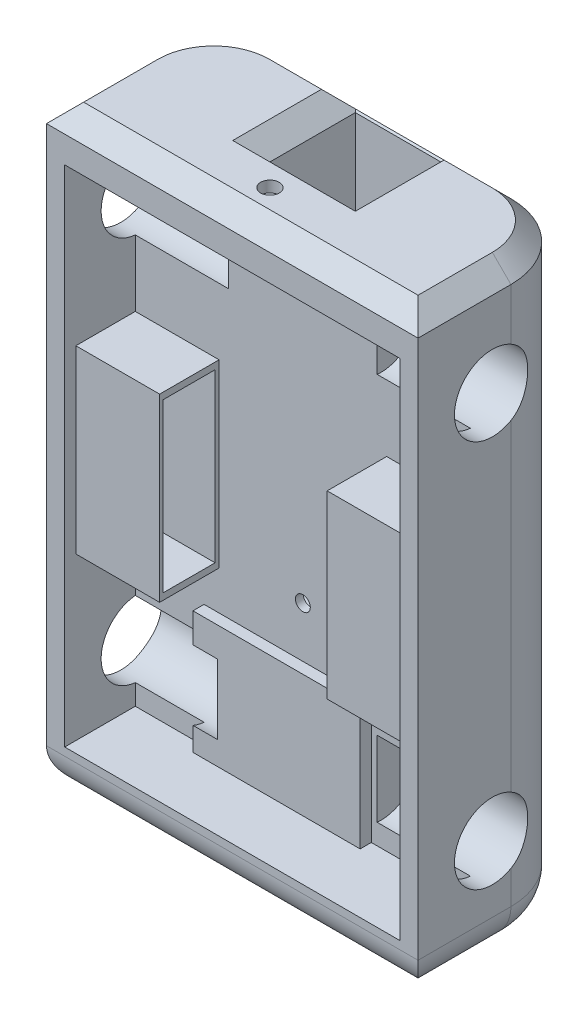
from build123d import *

# Parameters (mm, degrees)
SKETCH1_W             = 100
SKETCH1_H             = 160
BOSS_EXTRUDE1_DEPTH   = 20
BOSS_EXTRUDE2_DEPTH   = 160
FILLET4_R             = 10
SKETCH11_W            = 90.184018432
SKETCH11_H            = 135.686144012
CUT_EXTRUDE3_DEPTH    = 19
SKETCH12_W            = 23
SKETCH12_H            = 23
CUT_EXTRUDE4_DEPTH    = 110
SKETCH13_RX           = 15.4640355
SKETCH13_RY           = 8.1946903
CUT_EXTRUDE5_DEPTH    = 4
SKETCH15_R            = 2
CUT_EXTRUDE6_DEPTH    = 4
SKETCH22_W            = 22.546004608
SKETCH22_H            = 48.532413032
BOSS_EXTRUDE7_DEPTH   = 16
BOSS_EXTRUDE7_2_DEPTH = 16
SKETCH26_W            = 45
SKETCH26_H            = 33
BOSS_EXTRUDE8_DEPTH   = 3
SKETCH27_R            = 4
CUT_EXTRUDE13_DEPTH   = 3
SKETCH28_R            = 2.506731261
CUT_EXTRUDE14_DEPTH   = 3
SKETCH14_R            = 10.2
CUT_EXTRUDE15_DEPTH   = 30
SKETCH17_R            = 10.2
CUT_EXTRUDE16_DEPTH   = 30
SKETCH23_W            = 14
SKETCH23_H            = 45
CUT_EXTRUDE17_DEPTH   = 20
SKETCH24_W            = 14
SKETCH24_H            = 45
CUT_EXTRUDE18_DEPTH   = 20


with BuildPart() as part:
    # Sketch1 → Boss-Extrude1 (new body)
    with BuildSketch(Plane.XY):
        Rectangle(SKETCH1_W, SKETCH1_H)
    extrude(amount=BOSS_EXTRUDE1_DEPTH)

    # Sketch5 → Boss-Extrude2 (add)
    with BuildSketch(Plane(origin=(0, 80, 0), x_dir=(1, 0, 0), z_dir=(0, 1, 0))):
        with BuildLine():
            Line((50, 0), (-50, 0))
            Line((-50, 0), (-50, 5))
            ThreePointArc((-50, 5), (-44.142135624, 19.142135624), (-30, 25))
            Line((-30, 25), (30, 25))
            ThreePointArc((30, 25), (44.142135624, 19.142135624), (50, 5))
            Line((50, 5), (50, 0))
        make_face()
    extrude(amount=-BOSS_EXTRUDE2_DEPTH)

    # Fillet4
    fillet4_edges = [part.edges().sort_by_distance(p)[0] for p in [
        (-44.142135624, -80, -19.142135624),
        (0, -80, -25),
        (44.142135624, -80, -19.142135624),
        (0, -80, 20),
        (50, -80, 7.5),
        (-50, -80, 7.5),
    ]]
    fillet(fillet4_edges, radius=FILLET4_R)

    # Sketch11 → Cut-Extrude3 (cut)
    with BuildSketch(Plane.XY.offset(20)):
        Rectangle(SKETCH11_W, SKETCH11_H)
    extrude(amount=-CUT_EXTRUDE3_DEPTH, mode=Mode.SUBTRACT)

    # Sketch12 → Cut-Extrude4 (cut)
    with BuildSketch(Plane(origin=(0, 80, 0), x_dir=(1, 0, 0), z_dir=(0, 1, 0))):
        with Locations((0.5, 12.627685957)):
            Rectangle(SKETCH12_W, SKETCH12_H)
    extrude(amount=-CUT_EXTRUDE4_DEPTH, mode=Mode.SUBTRACT)

    # Sketch13 → Cut-Extrude5 (cut)
    with BuildSketch(Plane(origin=(0, 0, -25), x_dir=(-1, 0, 0), z_dir=(0, 0, -1))):
        with Locations(Location((0, 40), (0, 0, -90))):
            Ellipse(SKETCH13_RX, SKETCH13_RY)
    extrude(amount=-CUT_EXTRUDE5_DEPTH, mode=Mode.SUBTRACT)

    # Sketch15 → Cut-Extrude6 (cut)
    with BuildSketch(Plane(origin=(0, 0, -1.127685957), x_dir=(-1, 0, 0), z_dir=(0, 0, -1))):
        with Locations((0, -21.274761421)):
            Circle(SKETCH15_R)
    extrude(amount=-CUT_EXTRUDE6_DEPTH, mode=Mode.SUBTRACT)

    # Chamfer1
    # the kernel refuses this chamfer: 5 mm, written as the material it takes off along each edge
    with BuildSketch(Plane(origin=(30, 80, -5), x_dir=(0, 0, -1), z_dir=(-1, 0, 0))) as chamfer1_piece_1:
        with BuildLine():
            Line((14.858578644, -0.141421356), (20.141421356, 5.141421356))
            Line((20.141421356, 5.141421356), (20.241421356, 5.141421356))
            ThreePointArc((20.241421356, 5.141421356), (20.1, 2.570710678), (20.1, 0))
            Line((20.1, 0), (20, -0.1))
            ThreePointArc((20, -0.1), (17.429289322, -0.1), (14.858578644, -0.241421356))
            Line((14.858578644, -0.241421356), (14.858578644, -0.141421356))
        make_face()
    revolve(axis=Axis((30, 80, -5), (0, -1, 0)), revolution_arc=90, mode=Mode.SUBTRACT)
    with BuildSketch(Plane(origin=(-30, 80, -25), x_dir=(0, 0.0274958766105877, 0.9996219169112968), z_dir=(1, 0, 0))) as chamfer1_piece_2:
        with BuildLine():
            Line((5.143365976, 0), (-0.282735774, 5.135588968))
            Line((-0.282735774, 5.135588968), (-0.382697966, 5.13283938))
            ThreePointArc((-0.382697966, 5.13283938), (-0.170646135, 2.566989148), (-0.099962192, -0.002749588))
            Line((-0.099962192, -0.002749588), (0.002749588, -0.099962192))
            ThreePointArc((0.002749588, -0.099962192), (2.572488324, -0.029278248), (5.146115564, -0.099962192))
            Line((5.146115564, -0.099962192), (5.143365976, 0))
        make_face()
    extrude(amount=60, mode=Mode.SUBTRACT)
    with BuildSketch(Plane(origin=(-30, 80, -5), x_dir=(-1, 0, 0), z_dir=(0, 0, 1))) as chamfer1_piece_3:
        with BuildLine():
            Line((14.858578644, -0.141421356), (20.141421356, 5.141421356))
            Line((20.141421356, 5.141421356), (20.241421356, 5.141421356))
            ThreePointArc((20.241421356, 5.141421356), (20.1, 2.570710678), (20.1, 0))
            Line((20.1, 0), (20, -0.1))
            ThreePointArc((20, -0.1), (17.429289322, -0.1), (14.858578644, -0.241421356))
            Line((14.858578644, -0.241421356), (14.858578644, -0.141421356))
        make_face()
    revolve(axis=Axis((-30, 80, -5), (0, -1, 0)), revolution_arc=90, mode=Mode.SUBTRACT)
    with BuildSketch(Plane(origin=(12, 80, -1.127685957), x_dir=(0, 0.0274958766105877, 0.9996219169112968), z_dir=(-1, 0, 0)), Plane(origin=(-11, 80, -1.127685957), x_dir=(-0.9996219169112968, 0.0274958766105877, 0), z_dir=(0, 0, -1)), Plane(origin=(12, 80, -24.127685957), x_dir=(0.9996219169112965, 0.027495876610587732, 0), z_dir=(0, 0, 1)), Plane(origin=(-11, 80, -24.127685957), x_dir=(0, 0.0274958766105877, -0.9996219169112968), z_dir=(1, 0, 0))) as chamfer1_piece_4:
        with BuildLine():
            Line((5.143365976, 0), (-0.282735774, -5.135588968))
            Line((-0.282735774, -5.135588968), (-0.382697966, -5.13283938))
            ThreePointArc((-0.382697966, -5.13283938), (-0.170646135, -2.566989148), (-0.099962192, 0.002749588))
            Line((-0.099962192, 0.002749588), (0.002749588, 0.099962192))
            ThreePointArc((0.002749588, 0.099962192), (2.572488324, 0.029278248), (5.146115564, 0.099962192))
            Line((5.146115564, 0.099962192), (5.143365976, 0))
        make_face()
    extrude(amount=23, mode=Mode.SUBTRACT)
    with BuildSketch(Plane(origin=(-50, 80, -5), x_dir=(-0.027495876610586282, -0.9996219169112968, 0), z_dir=(0, 0, 1))) as chamfer1_piece_5:
        with BuildLine():
            Line((5.143365976, 0), (-0.282735774, 5.135588968))
            Line((-0.282735774, 5.135588968), (-0.382697966, 5.13283938))
            ThreePointArc((-0.382697966, 5.13283938), (-0.170646135, 2.566989148), (-0.099962192, -0.002749588))
            Line((-0.099962192, -0.002749588), (0.002749588, -0.099962192))
            ThreePointArc((0.002749588, -0.099962192), (2.572488324, -0.029278248), (5.146115564, -0.099962192))
            Line((5.146115564, -0.099962192), (5.143365976, 0))
        make_face()
    extrude(amount=25, mode=Mode.SUBTRACT)
    with BuildSketch(Plane(origin=(50, 80, 20), x_dir=(-0.9996219169112968, 0.0274958766105877, 0), z_dir=(0, 0, -1))) as chamfer1_piece_6:
        with BuildLine():
            Line((5.143365976, 0), (-0.282735774, -5.135588968))
            Line((-0.282735774, -5.135588968), (-0.382697966, -5.13283938))
            ThreePointArc((-0.382697966, -5.13283938), (-0.170646135, -2.566989148), (-0.099962192, 0.002749588))
            Line((-0.099962192, 0.002749588), (0.002749588, 0.099962192))
            ThreePointArc((0.002749588, 0.099962192), (2.572488324, 0.029278248), (5.146115564, 0.099962192))
            Line((5.146115564, 0.099962192), (5.143365976, 0))
        make_face()
    extrude(amount=25, mode=Mode.SUBTRACT)
    with BuildSketch(Plane(origin=(-50, 80, 20), x_dir=(0, -0.9996219169112968, 0.027495876610586282), z_dir=(1, 0, 0))) as chamfer1_piece_7:
        with BuildLine():
            Line((5.143365976, 0), (-0.282735774, 5.135588968))
            Line((-0.282735774, 5.135588968), (-0.382697966, 5.13283938))
            ThreePointArc((-0.382697966, 5.13283938), (-0.170646135, 2.566989148), (-0.099962192, -0.002749588))
            Line((-0.099962192, -0.002749588), (0.002749588, -0.099962192))
            ThreePointArc((0.002749588, -0.099962192), (2.572488324, -0.029278248), (5.146115564, -0.099962192))
            Line((5.146115564, -0.099962192), (5.143365976, 0))
        make_face()
    extrude(amount=100, mode=Mode.SUBTRACT)
    with BuildSketch(Plane(origin=(12, 80, -24.127685957), x_dir=(0.9996219169112965, 0.027495876610587732, 0), z_dir=(0, 0, 1))) as chamfer1_piece_8a_section:
        with BuildLine():
            Line((5.143365976, 0), (-0.282735774, -5.135588968))
            Line((-0.282735774, -5.135588968), (-0.382697966, -5.13283938))
            ThreePointArc((-0.382697966, -5.13283938), (-0.170646135, -2.566989148), (-0.099962192, 0.002749588))
            Line((-0.099962192, 0.002749588), (0.002749588, 0.099962192))
            ThreePointArc((0.002749588, 0.099962192), (2.572488324, 0.029278248), (5.146115564, 0.099962192))
            Line((5.146115564, 0.099962192), (5.143365976, 0))
        make_face()
    chamfer1_piece_8a = extrude(amount=35.85841494, mode=Mode.PRIVATE)
    chamfer1_piece_8a = split(chamfer1_piece_8a, bisect_by=Plane(origin=(13.648968134, 78.351031866, -1.127685957), z_dir=(0, 0, 1)), keep=Keep.TOP, mode=Mode.PRIVATE)
    with BuildSketch(Plane(origin=(24.85841494, 80, -1.127685957), x_dir=(0, 0.0274958766105877, 0.9996219169112968), z_dir=(-1, 0, 0))) as chamfer1_piece_8b_section:
        with BuildLine():
            Line((5.143365976, 0), (-0.282735774, -5.135588968))
            Line((-0.282735774, -5.135588968), (-0.382697966, -5.13283938))
            ThreePointArc((-0.382697966, -5.13283938), (-0.170646135, -2.566989148), (-0.099962192, 0.002749588))
            Line((-0.099962192, 0.002749588), (0.002749588, 0.099962192))
            ThreePointArc((0.002749588, 0.099962192), (2.572488324, 0.029278248), (5.146115564, 0.099962192))
            Line((5.146115564, 0.099962192), (5.143365976, 0))
        make_face()
    chamfer1_piece_8b = extrude(amount=35.85841494, mode=Mode.PRIVATE)
    chamfer1_piece_8b = split(chamfer1_piece_8b, bisect_by=Plane(origin=(12, 78.351031866, 0.521282178), z_dir=(1, 0, 0)), keep=Keep.TOP, mode=Mode.PRIVATE)
    chamfer1_piece_8 = chamfer1_piece_8a & chamfer1_piece_8b
    add(chamfer1_piece_8, mode=Mode.SUBTRACT)
    with BuildSketch(Plane(origin=(-11, 80, 11.730728983), x_dir=(-0.9996219169112968, 0.0274958766105877, 0), z_dir=(0, 0, -1))) as chamfer1_piece_9a_section:
        with BuildLine():
            Line((5.143365976, 0), (-0.282735774, -5.135588968))
            Line((-0.282735774, -5.135588968), (-0.382697966, -5.13283938))
            ThreePointArc((-0.382697966, -5.13283938), (-0.170646135, -2.566989148), (-0.099962192, 0.002749588))
            Line((-0.099962192, 0.002749588), (0.002749588, 0.099962192))
            ThreePointArc((0.002749588, 0.099962192), (2.572488324, 0.029278248), (5.146115564, 0.099962192))
            Line((5.146115564, 0.099962192), (5.143365976, 0))
        make_face()
    chamfer1_piece_9a = extrude(amount=35.85841494, mode=Mode.PRIVATE)
    chamfer1_piece_9a = split(chamfer1_piece_9a, bisect_by=Plane(origin=(-12.648968134, 78.351031866, -1.127685957), z_dir=(0, 0, 1)), keep=Keep.TOP, mode=Mode.PRIVATE)
    with BuildSketch(Plane(origin=(12, 80, -1.127685957), x_dir=(0, 0.0274958766105877, 0.9996219169112968), z_dir=(-1, 0, 0))) as chamfer1_piece_9b_section:
        with BuildLine():
            Line((5.143365976, 0), (-0.282735774, -5.135588968))
            Line((-0.282735774, -5.135588968), (-0.382697966, -5.13283938))
            ThreePointArc((-0.382697966, -5.13283938), (-0.170646135, -2.566989148), (-0.099962192, 0.002749588))
            Line((-0.099962192, 0.002749588), (0.002749588, 0.099962192))
            ThreePointArc((0.002749588, 0.099962192), (2.572488324, 0.029278248), (5.146115564, 0.099962192))
            Line((5.146115564, 0.099962192), (5.143365976, 0))
        make_face()
    chamfer1_piece_9b = extrude(amount=35.85841494, mode=Mode.PRIVATE)
    chamfer1_piece_9b = split(chamfer1_piece_9b, bisect_by=Plane(origin=(-11, 78.351031866, 0.521282178), z_dir=(-1, 0, 0)), keep=Keep.TOP, mode=Mode.PRIVATE)
    chamfer1_piece_9 = chamfer1_piece_9a & chamfer1_piece_9b
    add(chamfer1_piece_9, mode=Mode.SUBTRACT)
    with BuildSketch(Plane(origin=(-23.85841494, 80, -24.127685957), x_dir=(0, 0.0274958766105877, -0.9996219169112968), z_dir=(1, 0, 0))) as chamfer1_piece_10a_section:
        with BuildLine():
            Line((5.143365976, 0), (-0.282735774, -5.135588968))
            Line((-0.282735774, -5.135588968), (-0.382697966, -5.13283938))
            ThreePointArc((-0.382697966, -5.13283938), (-0.170646135, -2.566989148), (-0.099962192, 0.002749588))
            Line((-0.099962192, 0.002749588), (0.002749588, 0.099962192))
            ThreePointArc((0.002749588, 0.099962192), (2.572488324, 0.029278248), (5.146115564, 0.099962192))
            Line((5.146115564, 0.099962192), (5.143365976, 0))
        make_face()
    chamfer1_piece_10a = extrude(amount=35.85841494, mode=Mode.PRIVATE)
    chamfer1_piece_10a = split(chamfer1_piece_10a, bisect_by=Plane(origin=(-11, 78.351031866, -25.776654091), z_dir=(-1, 0, 0)), keep=Keep.TOP, mode=Mode.PRIVATE)
    with BuildSketch(Plane(origin=(-11, 80, -1.127685957), x_dir=(-0.9996219169112968, 0.0274958766105877, 0), z_dir=(0, 0, -1))) as chamfer1_piece_10b_section:
        with BuildLine():
            Line((5.143365976, 0), (-0.282735774, -5.135588968))
            Line((-0.282735774, -5.135588968), (-0.382697966, -5.13283938))
            ThreePointArc((-0.382697966, -5.13283938), (-0.170646135, -2.566989148), (-0.099962192, 0.002749588))
            Line((-0.099962192, 0.002749588), (0.002749588, 0.099962192))
            ThreePointArc((0.002749588, 0.099962192), (2.572488324, 0.029278248), (5.146115564, 0.099962192))
            Line((5.146115564, 0.099962192), (5.143365976, 0))
        make_face()
    chamfer1_piece_10b = extrude(amount=35.85841494, mode=Mode.PRIVATE)
    chamfer1_piece_10b = split(chamfer1_piece_10b, bisect_by=Plane(origin=(-12.648968134, 78.351031866, -24.127685957), z_dir=(0, 0, -1)), keep=Keep.TOP, mode=Mode.PRIVATE)
    chamfer1_piece_10 = chamfer1_piece_10a & chamfer1_piece_10b
    add(chamfer1_piece_10, mode=Mode.SUBTRACT)
    with BuildSketch(Plane(origin=(12, 80, -36.986100896), x_dir=(0.9996219169112965, 0.027495876610587732, 0), z_dir=(0, 0, 1))) as chamfer1_piece_11a_section:
        with BuildLine():
            Line((5.143365976, 0), (-0.282735774, -5.135588968))
            Line((-0.282735774, -5.135588968), (-0.382697966, -5.13283938))
            ThreePointArc((-0.382697966, -5.13283938), (-0.170646135, -2.566989148), (-0.099962192, 0.002749588))
            Line((-0.099962192, 0.002749588), (0.002749588, 0.099962192))
            ThreePointArc((0.002749588, 0.099962192), (2.572488324, 0.029278248), (5.146115564, 0.099962192))
            Line((5.146115564, 0.099962192), (5.143365976, 0))
        make_face()
    chamfer1_piece_11a = extrude(amount=35.85841494, mode=Mode.PRIVATE)
    chamfer1_piece_11a = split(chamfer1_piece_11a, bisect_by=Plane(origin=(13.648968134, 78.351031866, -24.127685957), z_dir=(0, 0, -1)), keep=Keep.TOP, mode=Mode.PRIVATE)
    with BuildSketch(Plane(origin=(-11, 80, -24.127685957), x_dir=(0, 0.0274958766105877, -0.9996219169112968), z_dir=(1, 0, 0))) as chamfer1_piece_11b_section:
        with BuildLine():
            Line((5.143365976, 0), (-0.282735774, -5.135588968))
            Line((-0.282735774, -5.135588968), (-0.382697966, -5.13283938))
            ThreePointArc((-0.382697966, -5.13283938), (-0.170646135, -2.566989148), (-0.099962192, 0.002749588))
            Line((-0.099962192, 0.002749588), (0.002749588, 0.099962192))
            ThreePointArc((0.002749588, 0.099962192), (2.572488324, 0.029278248), (5.146115564, 0.099962192))
            Line((5.146115564, 0.099962192), (5.143365976, 0))
        make_face()
    chamfer1_piece_11b = extrude(amount=35.85841494, mode=Mode.PRIVATE)
    chamfer1_piece_11b = split(chamfer1_piece_11b, bisect_by=Plane(origin=(12, 78.351031866, -25.776654091), z_dir=(1, 0, 0)), keep=Keep.TOP, mode=Mode.PRIVATE)
    chamfer1_piece_11 = chamfer1_piece_11a & chamfer1_piece_11b
    add(chamfer1_piece_11, mode=Mode.SUBTRACT)
    with BuildSketch(Plane(origin=(-50, 80, -5), x_dir=(-0.027495876610586282, -0.9996219169112968, 0), z_dir=(0, 0, 1))) as chamfer1_piece_12a_section:
        with BuildLine():
            Line((5.143365976, 0), (-0.282735774, 5.135588968))
            Line((-0.282735774, 5.135588968), (-0.382697966, 5.13283938))
            ThreePointArc((-0.382697966, 5.13283938), (-0.170646135, 2.566989148), (-0.099962192, -0.002749588))
            Line((-0.099962192, -0.002749588), (0.002749588, -0.099962192))
            ThreePointArc((0.002749588, -0.099962192), (2.572488324, -0.029278248), (5.146115564, -0.099962192))
            Line((5.146115564, -0.099962192), (5.143365976, 0))
        make_face()
    chamfer1_piece_12a = extrude(amount=37.85841494, mode=Mode.PRIVATE)
    chamfer1_piece_12a = split(chamfer1_piece_12a, bisect_by=Plane(origin=(-48.351031866, 78.351031866, 20), z_dir=(0, 0, 1)), keep=Keep.TOP, mode=Mode.PRIVATE)
    with BuildSketch(Plane(origin=(-62.85841494, 80, 20), x_dir=(0, -0.9996219169112968, 0.027495876610586282), z_dir=(1, 0, 0))) as chamfer1_piece_12b_section:
        with BuildLine():
            Line((5.143365976, 0), (-0.282735774, 5.135588968))
            Line((-0.282735774, 5.135588968), (-0.382697966, 5.13283938))
            ThreePointArc((-0.382697966, 5.13283938), (-0.170646135, 2.566989148), (-0.099962192, -0.002749588))
            Line((-0.099962192, -0.002749588), (0.002749588, -0.099962192))
            ThreePointArc((0.002749588, -0.099962192), (2.572488324, -0.029278248), (5.146115564, -0.099962192))
            Line((5.146115564, -0.099962192), (5.143365976, 0))
        make_face()
    chamfer1_piece_12b = extrude(amount=112.85841494, mode=Mode.PRIVATE)
    chamfer1_piece_12b = split(chamfer1_piece_12b, bisect_by=Plane(origin=(-50, 78.351031866, 18.351031866), z_dir=(-1, 0, 0)), keep=Keep.TOP, mode=Mode.PRIVATE)
    chamfer1_piece_12 = chamfer1_piece_12a & chamfer1_piece_12b
    add(chamfer1_piece_12, mode=Mode.SUBTRACT)
    with BuildSketch(Plane(origin=(-50, 80, 20), x_dir=(0, -0.9996219169112968, 0.027495876610586282), z_dir=(1, 0, 0))) as chamfer1_piece_13a_section:
        with BuildLine():
            Line((5.143365976, 0), (-0.282735774, 5.135588968))
            Line((-0.282735774, 5.135588968), (-0.382697966, 5.13283938))
            ThreePointArc((-0.382697966, 5.13283938), (-0.170646135, 2.566989148), (-0.099962192, -0.002749588))
            Line((-0.099962192, -0.002749588), (0.002749588, -0.099962192))
            ThreePointArc((0.002749588, -0.099962192), (2.572488324, -0.029278248), (5.146115564, -0.099962192))
            Line((5.146115564, -0.099962192), (5.143365976, 0))
        make_face()
    chamfer1_piece_13a = extrude(amount=112.85841494, mode=Mode.PRIVATE)
    chamfer1_piece_13a = split(chamfer1_piece_13a, bisect_by=Plane(origin=(50, 78.351031866, 18.351031866), z_dir=(1, 0, 0)), keep=Keep.TOP, mode=Mode.PRIVATE)
    with BuildSketch(Plane(origin=(50, 80, 32.85841494), x_dir=(-0.9996219169112968, 0.0274958766105877, 0), z_dir=(0, 0, -1))) as chamfer1_piece_13b_section:
        with BuildLine():
            Line((5.143365976, 0), (-0.282735774, -5.135588968))
            Line((-0.282735774, -5.135588968), (-0.382697966, -5.13283938))
            ThreePointArc((-0.382697966, -5.13283938), (-0.170646135, -2.566989148), (-0.099962192, 0.002749588))
            Line((-0.099962192, 0.002749588), (0.002749588, 0.099962192))
            ThreePointArc((0.002749588, 0.099962192), (2.572488324, 0.029278248), (5.146115564, 0.099962192))
            Line((5.146115564, 0.099962192), (5.143365976, 0))
        make_face()
    chamfer1_piece_13b = extrude(amount=37.85841494, mode=Mode.PRIVATE)
    chamfer1_piece_13b = split(chamfer1_piece_13b, bisect_by=Plane(origin=(48.351031866, 78.351031866, 20), z_dir=(0, 0, 1)), keep=Keep.TOP, mode=Mode.PRIVATE)
    chamfer1_piece_13 = chamfer1_piece_13a & chamfer1_piece_13b
    add(chamfer1_piece_13, mode=Mode.SUBTRACT)

    # Sketch26 → Boss-Extrude8 (add)
    with BuildSketch(Plane.XY.offset(1)):
        with Locations((-4.083795183, -51.343072006)):
            Rectangle(SKETCH26_W, SKETCH26_H)
    extrude(amount=BOSS_EXTRUDE8_DEPTH)

    # Sketch27 → Cut-Extrude13 (cut)
    with BuildSketch(Plane.XZ.offset(80)):
        with Locations(Location((0, 2.5, 0), (0, 0, 270))):
            Circle(SKETCH27_R)
        with Locations(Location((-25, 2.5, 0), (0, 0, 270))):
            Circle(SKETCH27_R)
        with Locations(Location((25, 2.5, 0), (0, 0, 270))):
            Circle(SKETCH27_R)
    extrude(amount=-CUT_EXTRUDE13_DEPTH, mode=Mode.SUBTRACT)

    # Sketch28 → Cut-Extrude14 (cut)
    with BuildSketch(Plane(origin=(0, 80, 0), x_dir=(1, 0, 0), z_dir=(0, 1, 0))):
        with Locations(Location((0, -9.853450589, 0), (0, 0, 270))):
            Circle(SKETCH28_R)
    extrude(amount=-CUT_EXTRUDE14_DEPTH, mode=Mode.SUBTRACT)

    # Sketch14 → Cut-Extrude15 (cut)
    with BuildSketch(Plane(origin=(50, 0, 0), x_dir=(0, 0, -1), z_dir=(1, 0, 0))):
        with Locations(Location((0, -52.197110406, 0), (0, 0, 299.353470055))):
            Circle(SKETCH14_R)
        with Locations(Location((0, 52.197110406, 0), (0, 0, 60.646529945))):
            Circle(SKETCH14_R)
    extrude(amount=-CUT_EXTRUDE15_DEPTH, mode=Mode.SUBTRACT)

    # Sketch17 → Cut-Extrude16 (cut)
    with BuildSketch(Plane.ZY.offset(50)):
        with Locations(Location((0, -52.165272983, 0), (0, 0, 293.088772437))):
            Circle(SKETCH17_R)
        with Locations(Location((0, 52.165272983, 0), (0, 0, 275.626270946))):
            Circle(SKETCH17_R)
    extrude(amount=-CUT_EXTRUDE16_DEPTH, mode=Mode.SUBTRACT)


with BuildPart() as body_2:
    # Sketch22 → Boss-Extrude7 (new body)
    with BuildSketch(Plane.XY.offset(1)):
        with Locations((-33.819006912, -0.086877249)):
            Rectangle(SKETCH22_W, SKETCH22_H)
    extrude(amount=BOSS_EXTRUDE7_DEPTH)

    # Sketch23 → Cut-Extrude17 (cut)
    with BuildSketch(Plane(origin=(-22.546004608, 0, 0), x_dir=(0, 0, -1), z_dir=(1, 0, 0))):
        with Locations((-9.070275609, -0.09965853)):
            Rectangle(SKETCH23_W, SKETCH23_H)
    extrude(amount=-CUT_EXTRUDE17_DEPTH, mode=Mode.SUBTRACT)


with BuildPart() as body_3:
    # Sketch22 → Boss-Extrude7 2 (new body)
    with BuildSketch(Plane.XY.offset(1)):
        with Locations((33.819006912, -0.086877249)):
            Rectangle(SKETCH22_W, SKETCH22_H)
    extrude(amount=BOSS_EXTRUDE7_2_DEPTH)

    # Sketch24 → Cut-Extrude18 (cut)
    with BuildSketch(Plane.ZY.offset(-22.546004608)):
        with Locations((9.143154752, 0.150993818)):
            Rectangle(SKETCH24_W, SKETCH24_H)
    extrude(amount=-CUT_EXTRUDE18_DEPTH, mode=Mode.SUBTRACT)


solid = Compound([part.part, body_2.part, body_3.part])
